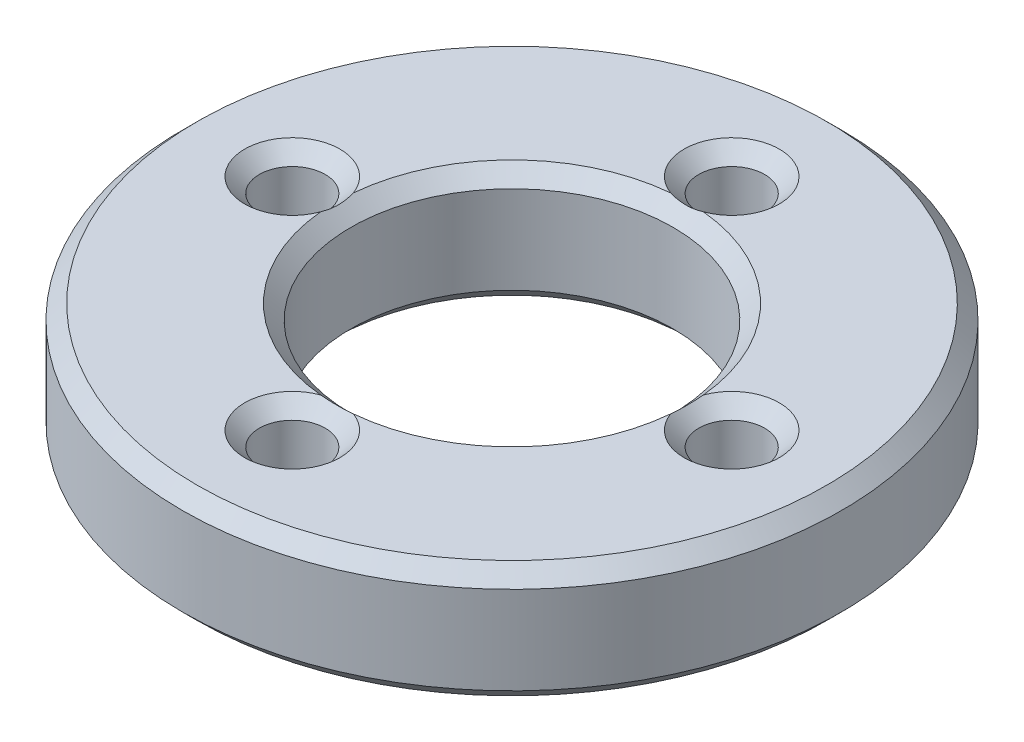
from build123d import *

# Parameters (mm, degrees)
SKETCH1_R           = 22.5
SKETCH1_R_2         = 11
SKETCH1_R_3         = 2.25
BOSS_EXTRUDE1_DEPTH = 8
CHAMFER1_SIZE       = 1


with BuildPart() as part:
    # Sketch1 → Boss-Extrude1 (new body)
    with BuildSketch(Plane(origin=(0, 0, 0), x_dir=(1, 0, 0), z_dir=(0, 1, 0))):
        with Locations(Location((0, 0, 0), (0, 0, 270))):
            Circle(SKETCH1_R)
        with Locations(Location((0, 0, 0), (0, 0, 270))):
            Circle(SKETCH1_R_2, mode=Mode.SUBTRACT)
        with Locations(Location((-15, 0, 0), (0, 0, 270))):
            Circle(SKETCH1_R_3, mode=Mode.SUBTRACT)
        with Locations(Location((15, 0, 0), (0, 0, 270))):
            Circle(SKETCH1_R_3, mode=Mode.SUBTRACT)
        with Locations(Location((0, -15, 0), (0, 0, 270))):
            Circle(SKETCH1_R_3, mode=Mode.SUBTRACT)
        with Locations(Location((0, 15, 0), (0, 0, 270))):
            Circle(SKETCH1_R_3, mode=Mode.SUBTRACT)
    extrude(amount=BOSS_EXTRUDE1_DEPTH)

    # Chamfer1
    # the kernel refuses this chamfer: 1 mm, written as the material it takes off along each edge
    with BuildSketch(Plane(origin=(15, 0, 0), x_dir=(0, 0, 1), z_dir=(-1, 0, 0))) as chamfer1_piece_1:
        Polygon((2.25, CHAMFER1_SIZE), (2.25 + CHAMFER1_SIZE, 0), (2.25, 0), align=None)
    revolve(axis=Axis((15, 0, 0), (0, 1, 0)), mode=Mode.SUBTRACT)
    with BuildSketch(Plane(origin=(15, 8, 0), x_dir=(0, 0, 1), z_dir=(-1, 0, 0))) as chamfer1_piece_2:
        Polygon((2.25, -CHAMFER1_SIZE), (2.25 + CHAMFER1_SIZE, 0), (2.25, 0), align=None)
    revolve(axis=Axis((15, 8, 0), (0, 1, 0)), mode=Mode.SUBTRACT)
    with BuildSketch(Plane(origin=(0, 0, -15), x_dir=(0, 0, 1), z_dir=(-1, 0, 0))) as chamfer1_piece_3:
        Polygon((2.25, CHAMFER1_SIZE), (2.25 + CHAMFER1_SIZE, 0), (2.25, 0), align=None)
    revolve(axis=Axis((0, 0, -15), (0, 1, 0)), mode=Mode.SUBTRACT)
    with BuildSketch(Plane(origin=(0, 8, -15), x_dir=(0, 0, 1), z_dir=(-1, 0, 0))) as chamfer1_piece_4:
        Polygon((2.25, -CHAMFER1_SIZE), (2.25 + CHAMFER1_SIZE, 0), (2.25, 0), align=None)
    revolve(axis=Axis((0, 8, -15), (0, 1, 0)), mode=Mode.SUBTRACT)
    with BuildSketch(Plane(origin=(0, 0, 0), x_dir=(0, 0, 1), z_dir=(-1, 0, 0))) as chamfer1_piece_5:
        Polygon((22.5, CHAMFER1_SIZE), (22.5 - CHAMFER1_SIZE, 0), (22.5, 0), align=None)
    revolve(axis=Axis((0, 0, 0), (0, 1, 0)), mode=Mode.SUBTRACT)
    with BuildSketch(Plane(origin=(-15, 0, 0), x_dir=(0, 0, 1), z_dir=(-1, 0, 0))) as chamfer1_piece_6:
        Polygon((2.25, CHAMFER1_SIZE), (2.25 + CHAMFER1_SIZE, 0), (2.25, 0), align=None)
    revolve(axis=Axis((-15, 0, 0), (0, 1, 0)), mode=Mode.SUBTRACT)
    with BuildSketch(Plane(origin=(-15, 8, 0), x_dir=(0, 0, 1), z_dir=(-1, 0, 0))) as chamfer1_piece_7:
        Polygon((2.25, -CHAMFER1_SIZE), (2.25 + CHAMFER1_SIZE, 0), (2.25, 0), align=None)
    revolve(axis=Axis((-15, 8, 0), (0, 1, 0)), mode=Mode.SUBTRACT)
    with BuildSketch(Plane(origin=(0, 8, 0), x_dir=(0, 0, 1), z_dir=(-1, 0, 0))) as chamfer1_piece_8:
        Polygon((22.5, -CHAMFER1_SIZE), (22.5 - CHAMFER1_SIZE, 0), (22.5, 0), align=None)
    revolve(axis=Axis((0, 8, 0), (0, 1, 0)), mode=Mode.SUBTRACT)
    with BuildSketch(Plane(origin=(0, 0, 0), x_dir=(0, 0, 1), z_dir=(-1, 0, 0))) as chamfer1_piece_9:
        Polygon((11, CHAMFER1_SIZE), (11 + CHAMFER1_SIZE, 0), (11, 0), align=None)
    revolve(axis=Axis((0, 0, 0), (0, 1, 0)), mode=Mode.SUBTRACT)
    with BuildSketch(Plane(origin=(0, 8, 0), x_dir=(0, 0, 1), z_dir=(-1, 0, 0))) as chamfer1_piece_10:
        Polygon((11, -CHAMFER1_SIZE), (11 + CHAMFER1_SIZE, 0), (11, 0), align=None)
    revolve(axis=Axis((0, 8, 0), (0, 1, 0)), mode=Mode.SUBTRACT)
    with BuildSketch(Plane(origin=(0, 0, 15), x_dir=(0, 0, 1), z_dir=(-1, 0, 0))) as chamfer1_piece_11:
        Polygon((2.25, CHAMFER1_SIZE), (2.25 + CHAMFER1_SIZE, 0), (2.25, 0), align=None)
    revolve(axis=Axis((0, 0, 15), (0, 1, 0)), mode=Mode.SUBTRACT)
    with BuildSketch(Plane(origin=(0, 8, 15), x_dir=(0, 0, 1), z_dir=(-1, 0, 0))) as chamfer1_piece_12:
        Polygon((2.25, -CHAMFER1_SIZE), (2.25 + CHAMFER1_SIZE, 0), (2.25, 0), align=None)
    revolve(axis=Axis((0, 8, 15), (0, 1, 0)), mode=Mode.SUBTRACT)


solid = part.part
